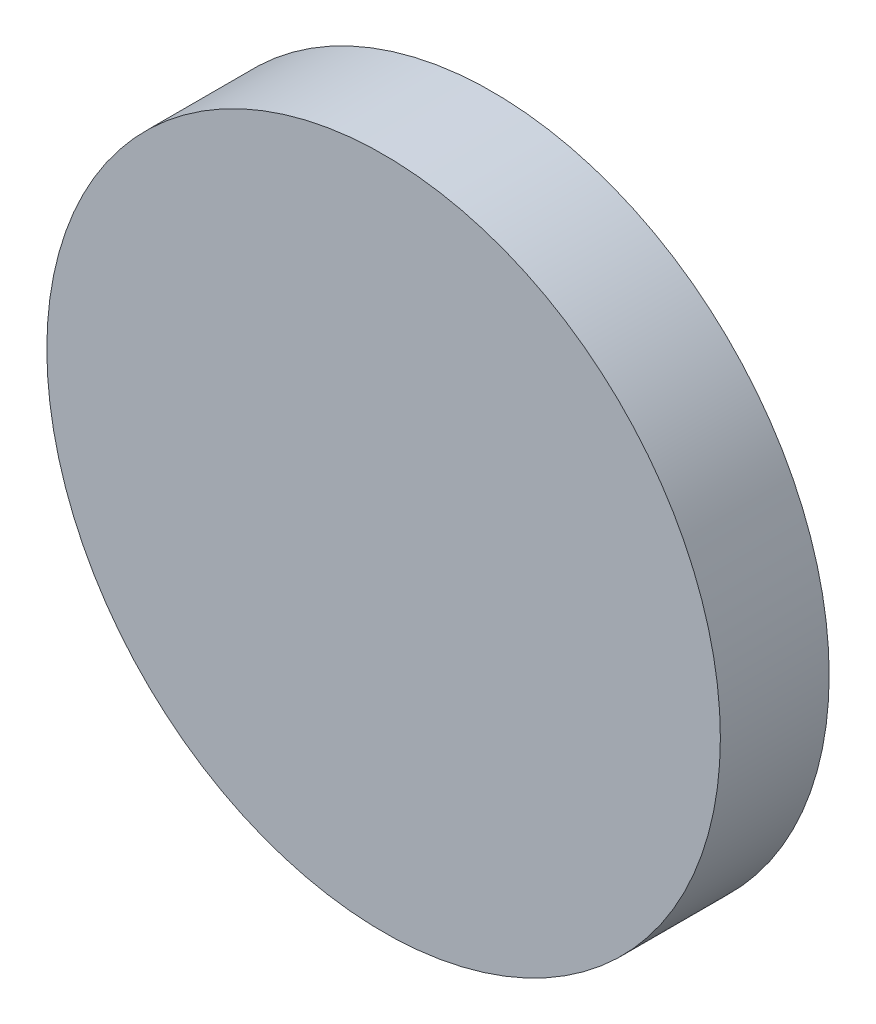
from build123d import *

# Parameters (mm, degrees)
SKETCH1_R           = 30.955
BOSS_EXTRUDE1_DEPTH = 10


with BuildPart() as part:
    # Sketch1 → Boss-Extrude1 (new body)
    with BuildSketch(Plane.XY):
        Circle(SKETCH1_R)
    extrude(amount=BOSS_EXTRUDE1_DEPTH)


solid = part.part
